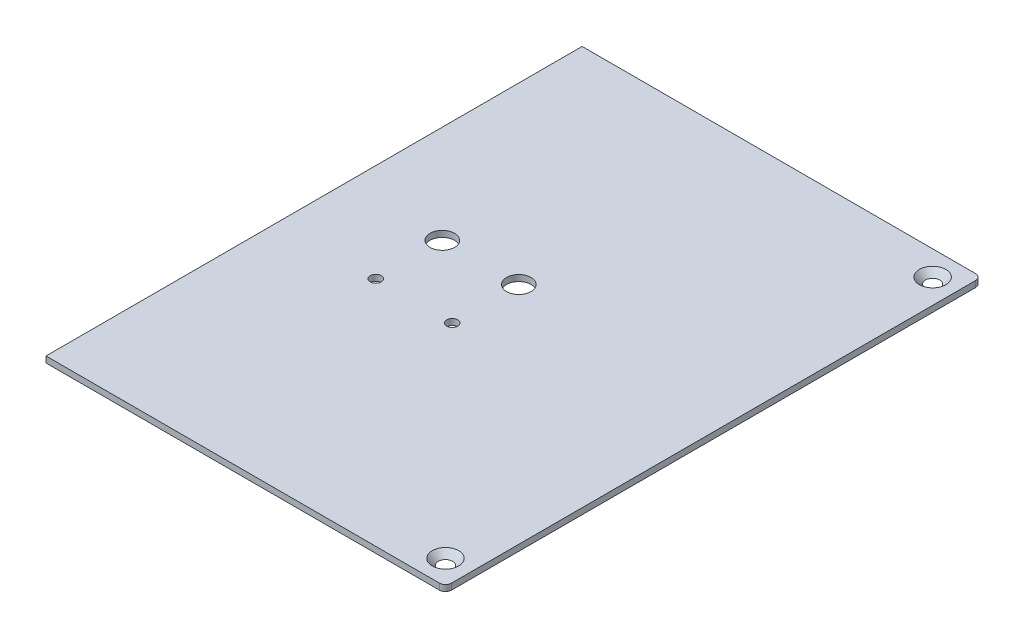
from build123d import *

# Parameters (mm, degrees)
SKETCH1_W                                    = 114.3
SKETCH1_H                                    = 111.252
BOSS_EXTRUDE1_DEPTH                          = 1.27
CSK_FOR_M2_5_COUNTERSUNK_FLAT_HEAD_S_2_COUNT = 2
CSK_FOR_M2_5_COUNTERSUNK_FLAT_HEAD_S_2_PITCH = 104.140077439
CSK_FOR_M2_5_COUNTERSUNK_FLAT_HEAD_S_3_COUNT = 2
CSK_FOR_M2_5_COUNTERSUNK_FLAT_HEAD_S_3_PITCH = 145.225430146
CSK_FOR_M2_5_COUNTERSUNK_FLAT_HEAD_S_4_COUNT = 2
CSK_FOR_M2_5_COUNTERSUNK_FLAT_HEAD_S_4_PITCH = 101.219
FILLET1_R                                    = 1.27
CUT_EXTRUDE1_REACH                           = 108.682
SKETCH4_W                                    = 31.403823389
SKETCH4_H                                    = 111.252
SKETCH5_R                                    = 1.143
CUT_EXTRUDE2_DEPTH                           = 2.54
SKETCH6_R                                    = 2.54
CUT_EXTRUDE3_DEPTH                           = 2.54


with BuildPart() as part:
    # Sketch1 → Boss-Extrude1 (new body)
    with BuildSketch(Plane(origin=(0, 0, 0), x_dir=(1, 0, 0), z_dir=(0, 1, 0))):
        with Locations((-13.076419672, -24.671311475)):
            Rectangle(SKETCH1_W, SKETCH1_H)
    extrude(amount=BOSS_EXTRUDE1_DEPTH)

    # Sketch3 → CSK for M2.5 Countersunk Flat Head Screw1 (revolve, cut)
    with BuildSketch(Plane(origin=(-65.146419672, 1.27, -26.001688525), x_dir=(0, 0, 1), z_dir=(1, 0, 0))):
        Polygon((0, 0), (0, 1.27), (1.45, 1.27), (1.45, 1.3), (2.75, 0), align=None)
    csk_for_m2_5_countersunk_flat_head_screw = revolve(axis=Axis((-65.146419672, 7.62, -26.001688525), (0, -1, 0)), mode=Mode.SUBTRACT)

    # CSK for M2.5 Countersunk Flat Head S 2: CSK for M2.5 Countersunk Flat Head Screw1 ×2
    with Locations(*[Vector(0.9999992563958324, 0, 0.0012195112882876242) * (i * CSK_FOR_M2_5_COUNTERSUNK_FLAT_HEAD_S_2_PITCH) for i in range(1, CSK_FOR_M2_5_COUNTERSUNK_FLAT_HEAD_S_2_COUNT)]):
        add(csk_for_m2_5_countersunk_flat_head_screw, mode=Mode.SUBTRACT)

    # CSK for M2.5 Countersunk Flat Head S 3: CSK for M2.5 Countersunk Flat Head Screw1 ×2
    with Locations(*[Vector(0.7170920402544414, 0, 0.6969784830277923) * (i * CSK_FOR_M2_5_COUNTERSUNK_FLAT_HEAD_S_3_PITCH) for i in range(1, CSK_FOR_M2_5_COUNTERSUNK_FLAT_HEAD_S_3_COUNT)]):
        add(csk_for_m2_5_countersunk_flat_head_screw, mode=Mode.SUBTRACT)

    # CSK for M2.5 Countersunk Flat Head S 4: CSK for M2.5 Countersunk Flat Head Screw1 ×2
    with Locations(*[(0, 0, i * CSK_FOR_M2_5_COUNTERSUNK_FLAT_HEAD_S_4_PITCH) for i in range(1, CSK_FOR_M2_5_COUNTERSUNK_FLAT_HEAD_S_4_COUNT)]):
        add(csk_for_m2_5_countersunk_flat_head_screw, mode=Mode.SUBTRACT)

    # Fillet1
    fillet1_edges = [part.edges().sort_by_distance(p)[0] for p in [
        (-70.226419672, 0.635, 80.297311475),
        (44.073580328, 0.635, 80.297311475),
        (44.073580328, 0.635, -30.954688525),
        (-70.226419672, 0.635, -30.954688525),
    ]]
    fillet(fillet1_edges, radius=FILLET1_R)

    # Sketch4 → Cut-Extrude1 (cut, up to next)
    with BuildSketch(Plane(origin=(0, 1.27, 0), x_dir=(1, 0, 0), z_dir=(0, 1, 0)), mode=Mode.PRIVATE) as cut_extrude1_sk1:
        with Locations((-54.524507978, -24.671311475)):
            Rectangle(SKETCH4_W, SKETCH4_H)
    cut_extrude1_tool1 = extrude(cut_extrude1_sk1.sketch, amount=-CUT_EXTRUDE1_REACH, mode=Mode.PRIVATE) & part.part
    add(cut_extrude1_tool1.solids().sort_by_distance((-54.524508, 1.27, 24.671311))[0], mode=Mode.SUBTRACT)

    # Sketch5 → Cut-Extrude2 (cut)
    with BuildSketch(Plane(origin=(0, 1.27, 0), x_dir=(1, 0, 0), z_dir=(0, 1, 0))):
        with Locations((-18.480523672, -32.211936475)):
            Circle(SKETCH5_R)
        with Locations((-2.605523672, -32.211936475)):
            Circle(SKETCH5_R)
    extrude(amount=-CUT_EXTRUDE2_DEPTH, mode=Mode.SUBTRACT)

    # Sketch6 → Cut-Extrude3 (cut)
    with BuildSketch(Plane(origin=(0, 1.27, 0), x_dir=(1, 0, 0), z_dir=(0, 1, 0))):
        with Locations((-2.605523672, -18.400686475)):
            Circle(SKETCH6_R)
        with Locations((-18.480523672, -18.400686475)):
            Circle(SKETCH6_R)
    extrude(amount=-CUT_EXTRUDE3_DEPTH, mode=Mode.SUBTRACT)


solid = part.part
